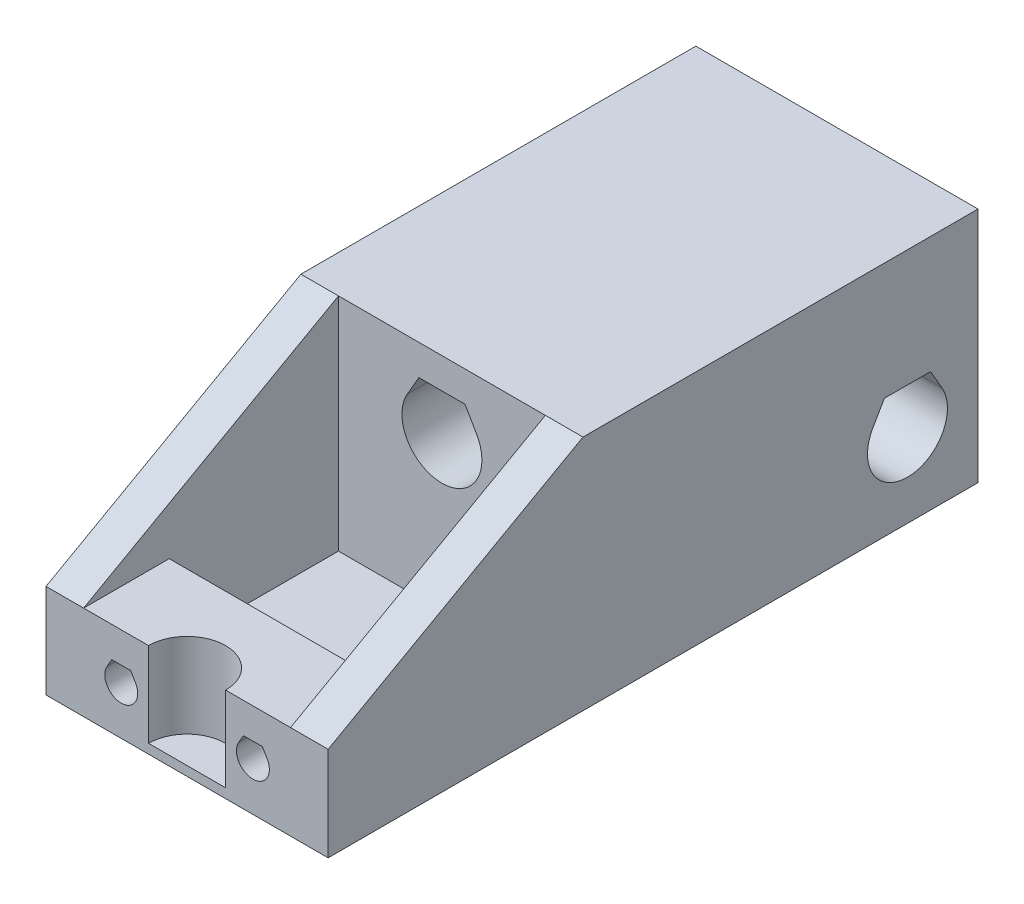
from build123d import *
from build123d.topology import SkipClean

# Parameters (mm, degrees)
SCHIZZO7_W                    = 30
SCHIZZO7_H                    = 24.2
ESTRUSIONE_ESTRUSIONE3_DEPTH  = 7.5
TAGLIO_ESTRUSIONE1_REACH      = 35.206
SCHIZZO12_W                   = 30
SCHIZZO12_H                   = 9
ESTRUSIONE_ESTRUSIONE5_DEPTH  = 54.1
TAGLIO_ESTRUSIONE3_REACH      = 67.197
SCHIZZO15_W                   = 22
SCHIZZO15_H                   = 18
TAGLIO_ESTRUSIONE4_DEPTH      = 8.3
TAGLIO_ESTRUSIONE5_REACH      = 73.737
TAGLIO_ESTRUSIONE6_DEPTH      = 3.1
SCHIZZO20_W                   = 30
SCHIZZO20_H                   = 15.2
ESTRUSIONE_ESTRUSIONE6_DEPTH  = 27
ESTRUSIONE_ESTRUSIONE7_DEPTH  = 4
ESTRUSIONE_ESTRUSIONE8_DEPTH  = 4
ESTRUSIONE_ESTRUSIONE9_DEPTH  = 1
ESTRUSIONE_ESTRUSIONE10_START = -13.1
ESTRUSIONE_ESTRUSIONE10_DEPTH = 1


# Read off the part's stored shape, not the designer's step: Estrusione-Estrusione10
with BuildPart() as part:
    # Schizzo7 → Estrusione-Estrusione3 (new, symmetric)
    with BuildSketch(Plane.XY):
        Rectangle(SCHIZZO7_W, SCHIZZO7_H)
        with BuildLine():
            Line((2.453738644, 8.85), (-2.453738644, 8.85))
            Line((-2.453738644, 8.85), (-3.680607966, 6.725))
            ThreePointArc((-3.680607966, 6.725), (0, 0.35), (3.680607966, 6.725))
            Line((3.680607966, 6.725), (2.453738644, 8.85))
        make_face(mode=Mode.SUBTRACT)
    extrude(amount=ESTRUSIONE_ESTRUSIONE3_DEPTH, both=True)

    # Schizzo8 → Taglio-Estrusione1 (cut, up to next)
    with BuildSketch(Plane(origin=(15, 0, 0), x_dir=(0, 0, -1), z_dir=(1, 0, 0)), mode=Mode.PRIVATE) as taglio_estrusione1_sk1:
        with BuildLine():
            Line((-2.453738644, -0.35), (2.453738644, -0.35))
            Line((2.453738644, -0.35), (3.680607966, -2.475))
            ThreePointArc((3.680607966, -2.475), (0, -8.85), (-3.680607966, -2.475))
            Line((-3.680607966, -2.475), (-2.453738644, -0.35))
        make_face()
    taglio_estrusione1_tool1 = extrude(taglio_estrusione1_sk1.sketch, amount=-TAGLIO_ESTRUSIONE1_REACH, mode=Mode.PRIVATE) & part.part
    add(taglio_estrusione1_tool1.solids().sort_by_distance((15, -4.474132, 0))[0], mode=Mode.SUBTRACT)

    # Schizzo12 → Estrusione-Estrusione5 (add)
    with BuildSketch(Plane.XY.offset(7.5)):
        with Locations((0, -7.6)):
            Rectangle(SCHIZZO12_W, SCHIZZO12_H)
    extrude(amount=ESTRUSIONE_ESTRUSIONE5_DEPTH)

    # Schizzo14 → Taglio-Estrusione3 (cut, up to next)
    with BuildSketch(Plane(origin=(0, -3.1, 0), x_dir=(1, 0, 0), z_dir=(0, 1, 0)), mode=Mode.PRIVATE) as taglio_estrusione3_sk1:
        with BuildLine():
            Line((4.1, -61.6), (-4.1, -61.6))
            ThreePointArc((-4.1, -61.6), (0, -57.5), (4.1, -61.6))
        make_face()
    taglio_estrusione3_tool1 = extrude(taglio_estrusione3_sk1.sketch, amount=-TAGLIO_ESTRUSIONE3_REACH, mode=Mode.PRIVATE) & part.part
    add(taglio_estrusione3_tool1.solids().sort_by_distance((0, -3.1, 59.859906))[0], mode=Mode.SUBTRACT)

    # Schizzo15 → Taglio-Estrusione4 (cut)
    with BuildSketch(Plane(origin=(0, -3.1, 0), x_dir=(1, 0, 0), z_dir=(0, 1, 0))):
        with Locations((0, -43.5)):
            Rectangle(SCHIZZO15_W, SCHIZZO15_H)
    extrude(amount=-TAGLIO_ESTRUSIONE4_DEPTH, mode=Mode.SUBTRACT)

    # Schizzo16 → Taglio-Estrusione5 (cut, up to next)
    with BuildSketch(Plane.XY.offset(61.6), mode=Mode.PRIVATE) as taglio_estrusione5_sk1:
        with BuildLine():
            Line((-8.010362971, -6.35), (-5.989637029, -6.35))
            Line((-5.989637029, -6.35), (-5.484455543, -7.225))
            ThreePointArc((-5.484455543, -7.225), (-7, -9.85), (-8.515544457, -7.225))
            Line((-8.515544457, -7.225), (-8.010362971, -6.35))
        make_face()
    taglio_estrusione5_tool1 = extrude(taglio_estrusione5_sk1.sketch, amount=-TAGLIO_ESTRUSIONE5_REACH, mode=Mode.PRIVATE) & part.part
    # Schizzo16 → Taglio-Estrusione5 (cut, up to next)
    with BuildSketch(Plane.XY.offset(61.6), mode=Mode.PRIVATE) as taglio_estrusione5_sk2:
        with BuildLine():
            Line((5.989637029, -6.35), (8.010362971, -6.35))
            Line((8.010362971, -6.35), (8.515544457, -7.225))
            ThreePointArc((8.515544457, -7.225), (7, -9.85), (5.484455543, -7.225))
            Line((5.484455543, -7.225), (5.989637029, -6.35))
        make_face()
    taglio_estrusione5_tool2 = extrude(taglio_estrusione5_sk2.sketch, amount=-TAGLIO_ESTRUSIONE5_REACH, mode=Mode.PRIVATE) & part.part
    add(taglio_estrusione5_tool1.solids().sort_by_distance((-7, -8.048172, 61.6))[0], mode=Mode.SUBTRACT)
    add(taglio_estrusione5_tool2.solids().sort_by_distance((7, -8.048172, 61.6))[0], mode=Mode.SUBTRACT)

    # Schizzo17 → Taglio-Estrusione6 (cut)
    with BuildSketch(Plane(origin=(0, 0, 52.5), x_dir=(-1, 0, 0), z_dir=(0, 0, -1))):
        Polygon((-7, -11.35), (-4.185417438, -9.725), (-4.185417438, -6.475), (-7, -4.85), (-9.814582562, -6.475), (-9.814582562, -9.725), align=None)
        Polygon((9.814582562, -9.725), (7, -11.35), (4.185417438, -9.725), (4.185417438, -6.475), (7, -4.85), (9.814582562, -6.475), align=None)
    extrude(amount=-TAGLIO_ESTRUSIONE6_DEPTH, mode=Mode.SUBTRACT)

    # Schizzo20 → Estrusione-Estrusione6 (add)
    with SkipClean():  # the faces are left unmerged after this step: merging them gives an invalid solid
        with BuildSketch(Plane.XY.offset(7.5)):
            with Locations((0, 4.5)):
                Rectangle(SCHIZZO20_W, SCHIZZO20_H)
            with BuildLine():
                Line((-2.453738644, 8.85), (2.453738644, 8.85))
                Line((2.453738644, 8.85), (3.680607966, 6.725))
                ThreePointArc((3.680607966, 6.725), (0, 0.35), (-3.680607966, 6.725))
                Line((-3.680607966, 6.725), (-2.453738644, 8.85))
            make_face(mode=Mode.SUBTRACT)
        extrude(amount=ESTRUSIONE_ESTRUSIONE6_DEPTH)

    # Schizzo21 → Estrusione-Estrusione7 (add)
    with SkipClean():  # the faces are left unmerged after this step: merging them gives an invalid solid
        with BuildSketch(Plane.ZY.offset(15)):
            Polygon((34.5, 12.1), (61.6, -3.1), (34.5, -3.1), align=None)
        extrude(amount=-ESTRUSIONE_ESTRUSIONE7_DEPTH)

    # Schizzo22 → Estrusione-Estrusione8 (add)
    with SkipClean():  # the faces are left unmerged after this step: merging them gives an invalid solid
        with BuildSketch(Plane(origin=(15, 0, 0), x_dir=(0, 0, -1), z_dir=(1, 0, 0))):
            Polygon((-34.5, 12.1), (-61.6, -3.1), (-34.5, -3.1), align=None)
        extrude(amount=-ESTRUSIONE_ESTRUSIONE8_DEPTH)

    # Schizzo24 → Estrusione-Estrusione9 (add)
    with SkipClean():  # the faces are left unmerged after this step: merging them gives an invalid solid
        with BuildSketch(Plane.XZ.offset(12.1)):
            with BuildLine():
                Line((15, 61.6), (4.1, 61.6))
                ThreePointArc((4.1, 61.6), (0, 57.5), (-4.1, 61.6))
                Line((-4.1, 61.6), (-15, 61.6))
                Line((-15, 61.6), (-15, -7.5))
                Line((-15, -7.5), (15, -7.5))
                Line((15, -7.5), (15, 61.6))
            make_face()
        extrude(amount=ESTRUSIONE_ESTRUSIONE9_DEPTH)

    # Estrusione-Estrusione10 outline → Estrusione-Estrusione10 (add)
    with SkipClean():  # the faces are left unmerged after this step: merging them gives an invalid solid
        with BuildSketch(Plane(origin=(0, 0, 0), x_dir=(1, 0, 0), z_dir=(0, 1, 0)).offset(ESTRUSIONE_ESTRUSIONE10_START)):
            with BuildLine():
                Line((-4.1, -61.6), (4.1, -61.6))
                ThreePointArc((4.1, -61.6), (0, -57.5), (-4.1, -61.6))
            make_face()
        extrude(amount=ESTRUSIONE_ESTRUSIONE10_DEPTH)


solid = part.part
